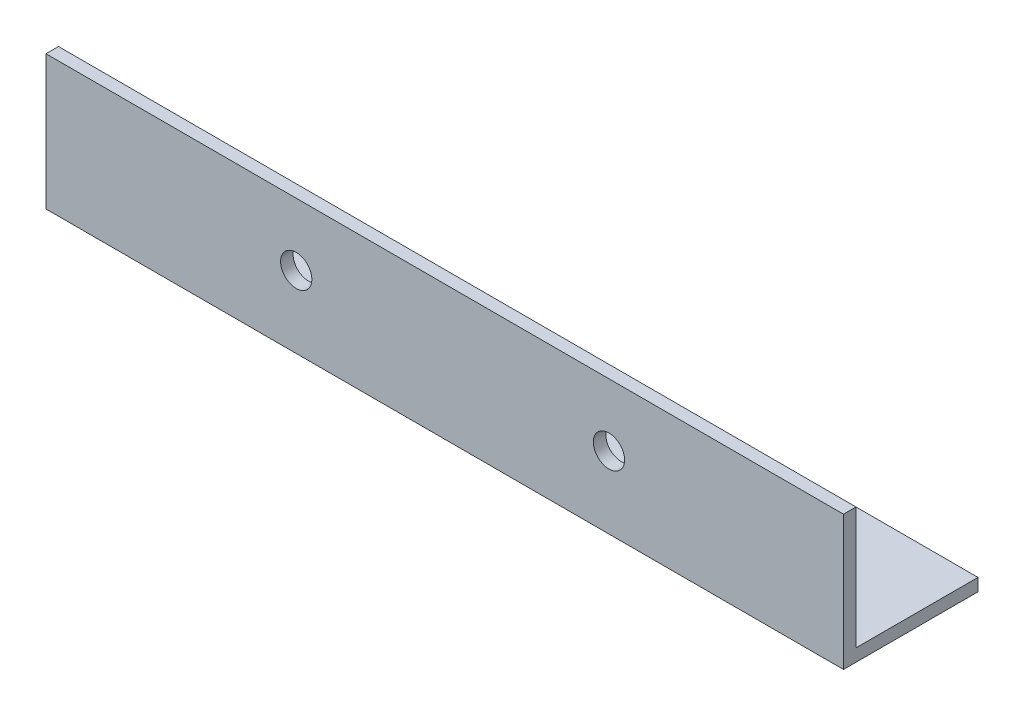
from build123d import *

# Parameters (mm, degrees)
EXTRUDE_1_DEPTH     = 255
SKETCH_2_R          = 5
CUT_EXTRUDE_1_DEPTH = 263.150720007


with BuildPart() as part:
    # Эскиз1 → Вытянуть-Тонкостенный1 (new body)
    with BuildSketch(Plane(origin=(0, 0, 0), x_dir=(0, 0, -1), z_dir=(1, 0, 0))):
        Polygon((0, 43), (0, 0), (43, 0), (43, 4), (4, 4), (4, 43), align=None)
    extrude(amount=EXTRUDE_1_DEPTH)

    # Эскиз2 → Вырез-Вытянуть1 (cut, through all)
    with BuildSketch(Plane.XY):
        with Locations((80, 23)):
            Circle(SKETCH_2_R)
        with Locations((180, 23)):
            Circle(SKETCH_2_R)
    extrude(amount=-CUT_EXTRUDE_1_DEPTH, mode=Mode.SUBTRACT)


solid = part.part
